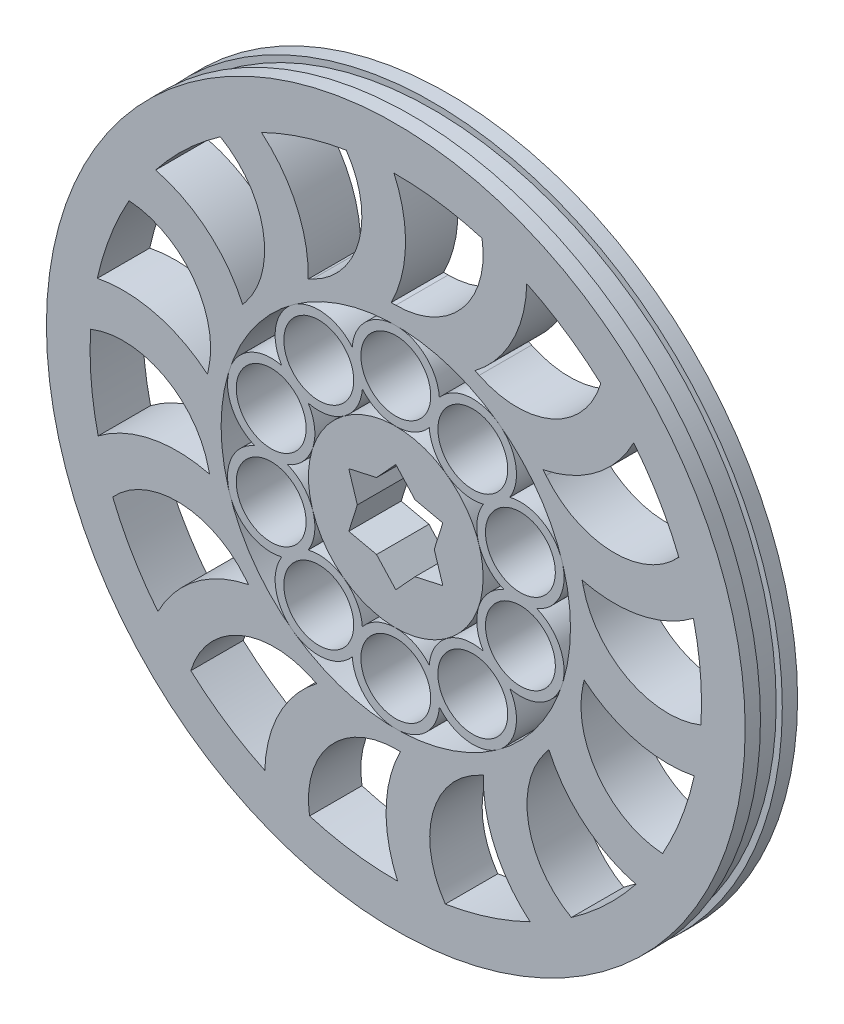
from build123d import *

# Parameters (mm, degrees)
SKETCH2_R           = 10
SKETCH2_R_2         = 1
BOSS_EXTRUDE2_DEPTH = 6
SKETCH3_R           = 5
SKETCH3_R_2         = 4
BOSS_EXTRUDE3_DEPTH = 6
CIRPATTERN1_COUNT   = 10
SKETCH5_R           = 22
SKETCH5_R_2         = 20
BOSS_EXTRUDE4_DEPTH = 6
SKETCH6_R           = 40
SKETCH6_R_2         = 35
BOSS_EXTRUDE5_DEPTH = 6
BOSS_EXTRUDE6_DEPTH = 6
CAVITY1_OUTLINE_R   = 1
CAVITY1_DEPTH       = 6
CUT_EXTRUDE1_DEPTH  = 6
SKETCH10_W          = 0.7
SKETCH10_H          = 1.25


# Read off the part's stored shape, not the designer's step: Cavity1
with BuildPart() as part:
    # Sketch2 → Boss-Extrude2 (new body)
    with BuildSketch(Plane.XY):
        Circle(SKETCH2_R)
        Circle(SKETCH2_R_2, mode=Mode.SUBTRACT)
    extrude(amount=BOSS_EXTRUDE2_DEPTH)

    # Cavity1 outline → Cavity1 (cut)
    with BuildSketch(Plane.XY):
        Polygon((5.127518984, -2.960374466), (4.194116501, 0), (5.127518984, 2.960374466), (2.09705825, 3.632211436), (0, 5.920748932), (-2.09705825, 3.632211436), (-5.127518984, 2.960374466), (-4.194116501, 0), (-5.127518984, -2.960374466), (-2.09705825, -3.632211436), (0, -5.920748932), (2.09705825, -3.632211436), align=None)
        Circle(CAVITY1_OUTLINE_R, mode=Mode.SUBTRACT)
    extrude(amount=CAVITY1_DEPTH, mode=Mode.SUBTRACT)

    # Sketch8 → Cut-Extrude1 (cut)
    # profile 1 of 2: a face of its own
    with BuildSketch(Plane(origin=(0, 0, 0), x_dir=(-1, 0, 0), z_dir=(0, 0, -1))):
        Polygon((5.383894933, -3.108393189), (4.403822326, 0), (5.383894933, 3.108393189), (2.201911163, 3.813822008), (0, 6.216786378), (-2.201911163, 3.813822008), (-5.383894933, 3.108393189), (-4.403822326, 0), (-5.383894933, -3.108393189), (-2.201911163, -3.813822008), (0, -6.216786378), (2.201911163, -3.813822008), align=None)
        Polygon((-2.09705825, -3.632211436), (-5.127518984, -2.960374466), (-4.194116501, 0), (-5.127518984, 2.960374466), (-2.09705825, 3.632211436), (0, 5.920748932), (2.09705825, 3.632211436), (5.127518984, 2.960374466), (4.194116501, 0), (5.127518984, -2.960374466), (2.09705825, -3.632211436), (0, -5.920748932), align=None, mode=Mode.SUBTRACT)
    # profile 2 of 2: a face of its own
    with BuildSketch(Plane(origin=(0, 0, 0), x_dir=(-1, 0, 0), z_dir=(0, 0, -1))):
        Polygon((-5.127518984, -2.960374466), (-4.194116501, 0), (-5.127518984, 2.960374466), (-2.09705825, 3.632211436), (0, 5.920748932), (2.09705825, 3.632211436), (5.127518984, 2.960374466), (4.194116501, 0), (5.127518984, -2.960374466), (2.09705825, -3.632211436), (0, -5.920748932), (-2.09705825, -3.632211436), align=None)
    extrude(amount=-CUT_EXTRUDE1_DEPTH, mode=Mode.SUBTRACT)


with BuildPart() as body_2:
    # Sketch3 → Boss-Extrude3 (new body)
    with BuildSketch(Plane.XY):
        with Locations((0, 15)):
            Circle(SKETCH3_R)
        with Locations((0, 15)):
            Circle(SKETCH3_R_2, mode=Mode.SUBTRACT)
    boss_extrude3 = extrude(amount=BOSS_EXTRUDE3_DEPTH)

    # CirPattern1: Boss-Extrude3 ×10 about axis
    cirpattern1_axis = Axis((0, 0, 0), (0, 0, 1))
    for i in range(1, CIRPATTERN1_COUNT):
        add(boss_extrude3.rotate(cirpattern1_axis, i * 360 / CIRPATTERN1_COUNT))


with BuildPart() as body_3:
    # Sketch5 → Boss-Extrude4 (new body)
    with BuildSketch(Plane.XY):
        Circle(SKETCH5_R)
        Circle(SKETCH5_R_2, mode=Mode.SUBTRACT)
    extrude(amount=BOSS_EXTRUDE4_DEPTH)



with BuildPart() as body_4:
    # Sketch6 → Boss-Extrude5 (new body)
    with BuildSketch(Plane.XY):
        Circle(SKETCH6_R)
        Circle(SKETCH6_R_2, mode=Mode.SUBTRACT)
    extrude(amount=BOSS_EXTRUDE5_DEPTH)


with BuildPart() as body_3_1:
    add(body_3.part)

    add(body_4.part)  # Boss-Extrude6 merges body 4
    # Sketch7 → Boss-Extrude6 (add)
    with BuildSketch(Plane.XY):
        with BuildLine():
            ThreePointArc((0, 22), (7.608588897, 25.510826324), (9.874690956, 33.578125))
            ThreePointArc((9.874690956, 33.578125), (12.473288788, 32.70194286), (14.995311767, 31.625))
            ThreePointArc((14.995311767, 31.625), (13.349298508, 25.159223045), (9.062163248, 20.046875))
            ThreePointArc((9.062163248, 20.046875), (4.635124054, 21.506176438), (0, 22))
        make_face()
        with BuildLine():
            ThreePointArc((16.862740045, 14.129684999), (13.507282719, 17.365290483), (9.545442261, 19.821315094))
            ThreePointArc((9.545442261, 19.821315094), (17.923834438, 19.683217312), (23.465791559, 25.968377433))
            ThreePointArc((23.465791559, 25.968377433), (25.426886123, 24.051475258), (27.231882316, 21.986918509))
            ThreePointArc((27.231882316, 21.986918509), (22.943480132, 16.875633153), (16.862740045, 14.129684999))
        make_face()
        with BuildLine():
            ThreePointArc((21.323444368, 5.413937595), (19.704158385, 9.784995775), (17.200292614, 13.716775641))
            ThreePointArc((17.200292614, 13.716775641), (24.689044747, 9.957105713), (32.409204355, 13.215274234))
            ThreePointArc((32.409204355, 13.215274234), (33.344376821, 10.63731801), (34.074844596, 7.994058155))
            ThreePointArc((34.074844596, 7.994058155), (27.993424133, 5.249617149), (21.323444368, 5.413937595))
        make_face()
        with BuildLine():
            ThreePointArc((21.560779019, -4.374106547), (21.998383828, 0.26666265), (21.448414068, 4.895460547))
            ThreePointArc((21.448414068, 4.895460547), (26.564286953, -1.741132788), (34.933576755, -2.155276102))
            ThreePointArc((34.933576755, -2.155276102), (34.657604747, -4.883690529), (34.168866002, -7.582123457))
            ThreePointArc((34.168866002, -7.582123457), (27.498927167, -7.416149914), (21.560779019, -4.374106547))
        make_face()
        with BuildLine():
            ThreePointArc((17.52773696, -13.295805243), (19.935559561, -9.304486284), (21.448414068, -4.895460547))
            ThreePointArc((21.448414068, -4.895460547), (23.178146338, -13.094518587), (30.538925847, -17.098947573))
            ThreePointArc((30.538925847, -17.098947573), (29.106469006, -19.437424263), (27.495324443, -21.65657253))
            ThreePointArc((27.495324443, -21.65657253), (21.557930424, -18.613057533), (17.52773696, -13.295805243))
        make_face()
        with BuildLine():
            ThreePointArc((10.023111632, -19.584106648), (13.924253229, -17.032767597), (17.200292614, -13.716775641))
            ThreePointArc((17.200292614, -13.716775641), (15.20128958, -21.854374387), (20.095666139, -28.655962772))
            ThreePointArc((20.095666139, -28.655962772), (17.790440111, -30.141337738), (15.37599667, -31.441671813))
            ThreePointArc((15.37599667, -31.441671813), (11.34712117, -26.123420834), (10.023111632, -19.584106648))
        make_face()
        with BuildLine():
            ThreePointArc((0.53328612, -21.993535548), (5.155077775, -21.387500395), (9.545442261, -19.821315094))
            ThreePointArc((9.545442261, -19.821315094), (4.213630989, -26.285703312), (5.672213296, -34.537313102))
            ThreePointArc((5.672213296, -34.537313102), (2.950796366, -34.875389615), (0.211264183, -34.999362386))
            ThreePointArc((0.211264183, -34.999362386), (-1.111124596, -28.459720256), (0.53328612, -21.993535548))
        make_face()
        with BuildLine():
            ThreePointArc((-9.062163248, -20.046875), (-4.635124054, -21.506176438), (0, -22))
            ThreePointArc((0, -22), (-7.608588897, -25.510826324), (-9.874690956, -33.578125))
            ThreePointArc((-9.874690956, -33.578125), (-12.473288788, -32.70194286), (-14.995311767, -31.625))
            ThreePointArc((-14.995311767, -31.625), (-13.349298508, -25.159223045), (-9.062163248, -20.046875))
        make_face()
        with BuildLine():
            ThreePointArc((-16.862740045, -14.129684999), (-13.507282719, -17.365290483), (-9.545442261, -19.821315094))
            ThreePointArc((-9.545442261, -19.821315094), (-17.923834438, -19.683217312), (-23.465791559, -25.968377433))
            ThreePointArc((-23.465791559, -25.968377433), (-25.426886123, -24.051475258), (-27.231882316, -21.986918509))
            ThreePointArc((-27.231882316, -21.986918509), (-22.943480132, -16.875633153), (-16.862740045, -14.129684999))
        make_face()
        with BuildLine():
            ThreePointArc((-21.323444368, -5.413937595), (-19.704158385, -9.784995775), (-17.200292614, -13.716775641))
            ThreePointArc((-17.200292614, -13.716775641), (-24.689044747, -9.957105713), (-32.409204355, -13.215274234))
            ThreePointArc((-32.409204355, -13.215274234), (-33.344376821, -10.63731801), (-34.074844596, -7.994058155))
            ThreePointArc((-34.074844596, -7.994058155), (-27.993424133, -5.249617149), (-21.323444368, -5.413937595))
        make_face()
        with BuildLine():
            ThreePointArc((-21.560779019, 4.374106547), (-21.998383828, -0.26666265), (-21.448414068, -4.895460547))
            ThreePointArc((-21.448414068, -4.895460547), (-26.564286953, 1.741132788), (-34.933576755, 2.155276102))
            ThreePointArc((-34.933576755, 2.155276102), (-34.657604747, 4.883690529), (-34.168866002, 7.582123457))
            ThreePointArc((-34.168866002, 7.582123457), (-27.498927167, 7.416149914), (-21.560779019, 4.374106547))
        make_face()
        with BuildLine():
            ThreePointArc((-17.52773696, 13.295805243), (-19.935559561, 9.304486284), (-21.448414068, 4.895460547))
            ThreePointArc((-21.448414068, 4.895460547), (-23.178146338, 13.094518587), (-30.538925847, 17.098947573))
            ThreePointArc((-30.538925847, 17.098947573), (-29.106469006, 19.437424263), (-27.495324443, 21.65657253))
            ThreePointArc((-27.495324443, 21.65657253), (-21.557930424, 18.613057533), (-17.52773696, 13.295805243))
        make_face()
        with BuildLine():
            ThreePointArc((-10.023111632, 19.584106648), (-13.924253229, 17.032767597), (-17.200292614, 13.716775641))
            ThreePointArc((-17.200292614, 13.716775641), (-15.20128958, 21.854374387), (-20.095666139, 28.655962772))
            ThreePointArc((-20.095666139, 28.655962772), (-17.790440111, 30.141337738), (-15.37599667, 31.441671813))
            ThreePointArc((-15.37599667, 31.441671813), (-11.34712117, 26.123420834), (-10.023111632, 19.584106648))
        make_face()
        with BuildLine():
            ThreePointArc((-0.53328612, 21.993535548), (-5.155077775, 21.387500395), (-9.545442261, 19.821315094))
            ThreePointArc((-9.545442261, 19.821315094), (-4.213630989, 26.285703312), (-5.672213296, 34.537313102))
            ThreePointArc((-5.672213296, 34.537313102), (-2.950796366, 34.875389615), (-0.211264183, 34.999362386))
            ThreePointArc((-0.211264183, 34.999362386), (1.111124596, 28.459720256), (-0.53328612, 21.993535548))
        make_face()
    extrude(amount=BOSS_EXTRUDE6_DEPTH)

    # Sketch10 → Cut-Revolve1 (revolve, cut)
    with BuildSketch(Plane(origin=(0, 0, 0), x_dir=(1, 0, 0), z_dir=(0, 1, 0))):
        with Locations((39.65, -2.375)):
            Rectangle(SKETCH10_W, SKETCH10_H)
        with Locations((39.65, -3.625)):
            Rectangle(SKETCH10_W, SKETCH10_H)
    revolve(axis=Axis((0, 0, 68.225396744), (0, 0, -1)), mode=Mode.SUBTRACT)


solid = Compound([part.part, body_2.part, body_3_1.part])
